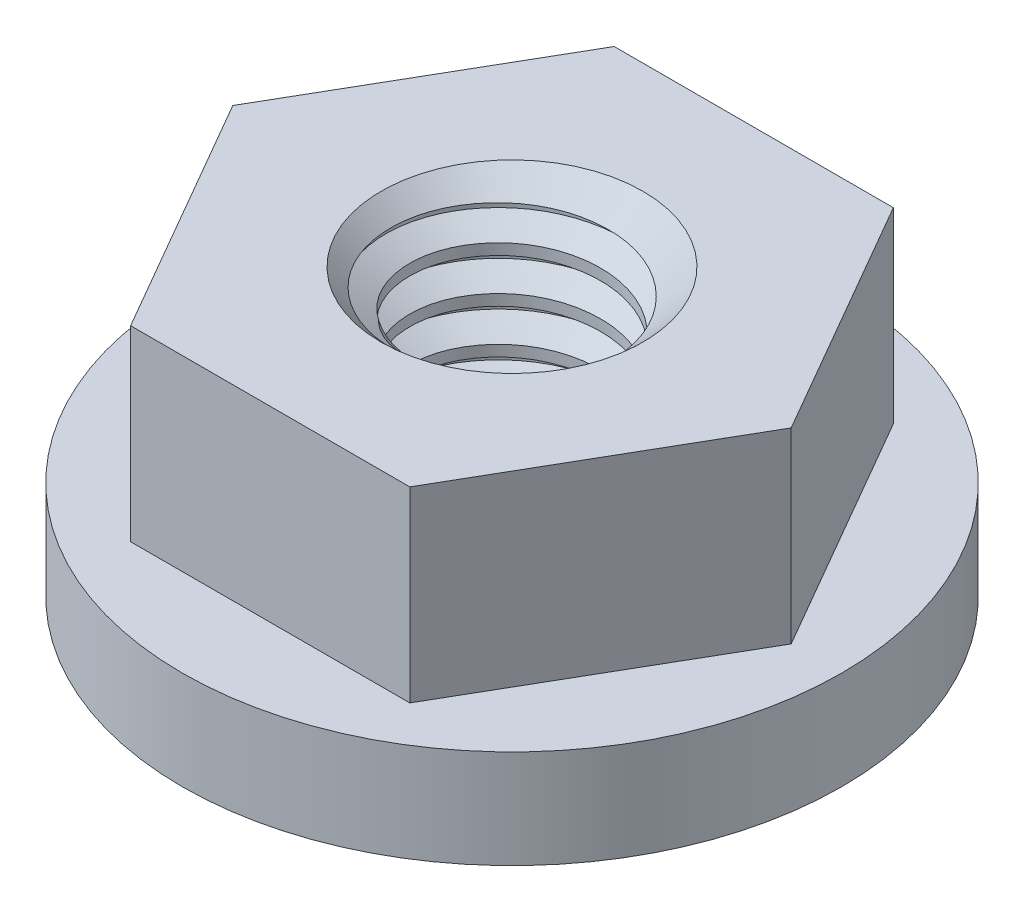
from build123d import *

# Parameters (mm, degrees)
SKETCH1_R           = 5.953125
BOSS_EXTRUDE1_DEPTH = 1.778
BOSS_EXTRUDE2_DEPTH = 3.3782
THREAD1_PITCH       = 0.79375


with BuildPart() as part:
    # Sketch1 → Boss-Extrude1 (new body)
    with BuildSketch(Plane(origin=(0, 0, 0), x_dir=(1, 0, 0), z_dir=(0, 1, 0))):
        with Locations(Location((0, 0, 0), (0, 0, 270))):
            Circle(SKETCH1_R)
    extrude(amount=BOSS_EXTRUDE1_DEPTH)

    # Sketch2 → Boss-Extrude2 (add)
    with BuildSketch(Plane(origin=(0, 1.778, 0), x_dir=(1, 0, 0), z_dir=(0, 1, 0))):
        Polygon((5.040989538, 0), (2.520494769, 4.365625), (-2.520494769, 4.365625), (-5.040989538, 0), (-2.520494769, -4.365625), (2.520494769, -4.365625), align=None)
    extrude(amount=BOSS_EXTRUDE2_DEPTH)

    # Sketch5 → Tap Drill for #8-32 Tap1 (revolve, cut)
    with BuildSketch(Plane(origin=(0, 5.1562, 0), x_dir=(0, 0, 1), z_dir=(1, 0, 0))):
        Polygon((0, 0), (0, 5.1562), (2.3622, 5.1562), (1.7272, 4.5212), (1.7272, 0.635), (2.3622, 0), align=None)
    revolve(axis=Axis((0, 11.5062, 0), (0, -1, 0)), mode=Mode.SUBTRACT)

    # Thread1: the profile of Thread Profile1 profile screwed along a right-hand helix of 7.296 turns, 8 arcs to a turn; built about Z, then put on its axis
    thread1_z = Axis((0, 0, 0), (0, 0, 1))
    thread1_corners = [(1.7269, 0, -0.000173205), (2.156829788, 0, 0.248046874), (2.156829788, 0, 0.347265624), (1.7269, 0, 0.595485703)]
    with BuildLine(mode=Mode.PRIVATE) as thread1_profile:
        Line(thread1_corners[0], thread1_corners[1])
        Line(thread1_corners[1], thread1_corners[2])
        Line(thread1_corners[2], thread1_corners[3])
        Line(thread1_corners[3], thread1_corners[0])
    thread1_cap = Face(thread1_profile.wire())
    thread1_turn_angles = [0, 22.5, 45, 67.5, 90, 112.5, 135, 157.5, 180, 202.5, 225, 247.5, 270, 292.5, 315, 337.5, 360]
    thread1_turn_weights = [1, 0.9238795325112867, 1, 0.9238795325112867, 1, 0.9238795325112867, 1, 0.9238795325112867, 1, 0.9238795325112867, 1, 0.9238795325112867, 1, 0.9238795325112867, 1, 0.9238795325112867, 1]
    thread1_turn_rails = [Edge.make_bspline([Vector(p[0], p[1], 0).rotate(thread1_z, thread1_turn_angles[k]) / thread1_turn_weights[k] + Vector(0, 0, p[2] + THREAD1_PITCH * thread1_turn_angles[k] / 360) for k in range(17)], [0, 0, 0, 1, 1, 2, 2, 3, 3, 4, 4, 5, 5, 6, 6, 7, 7, 8, 8, 8], 2, thread1_turn_weights) for p in thread1_corners]
    thread1_turn_sides = [Face.make_surface_from_curves(thread1_turn_rails[p[0]], thread1_turn_rails[p[1]]) for p in [(0, 1), (1, 2), (2, 3), (3, 0)]]
    thread1_last_angles = [2520, 2542.5, 2565, 2587.5, 2610, 2618.28, 2626.56]
    thread1_last_weights = [1, 0.9238795325112867, 1, 0.9238795325112867, 1, 0.989576118602651, 1]
    thread1_last_rails = [Edge.make_bspline([Vector(p[0], p[1], 0).rotate(thread1_z, thread1_last_angles[k]) / thread1_last_weights[k] + Vector(0, 0, p[2] + THREAD1_PITCH * thread1_last_angles[k] / 360) for k in range(7)], [0, 0, 0, 1, 1, 2, 2, 3, 3, 3], 2, thread1_last_weights) for p in thread1_corners]
    thread1_last_sides = [Face.make_surface_from_curves(thread1_last_rails[p[0]], thread1_last_rails[p[1]]) for p in [(0, 1), (1, 2), (2, 3), (3, 0)]]
    thread1 = Plane(origin=(0, 5.7912, 0), x_dir=(-1, 0, 0), z_dir=(0, -1, 0)) * Solid(Shell([*[p.moved(Location((0, 0, THREAD1_PITCH * i))) for i in range(7) for p in thread1_turn_sides], *thread1_last_sides, thread1_cap, thread1_cap.rotate(thread1_z, 2626.56).moved(Location((0, 0, THREAD1_PITCH * 2626.56 / 360)))]))
    add(thread1, mode=Mode.SUBTRACT)


solid = part.part
